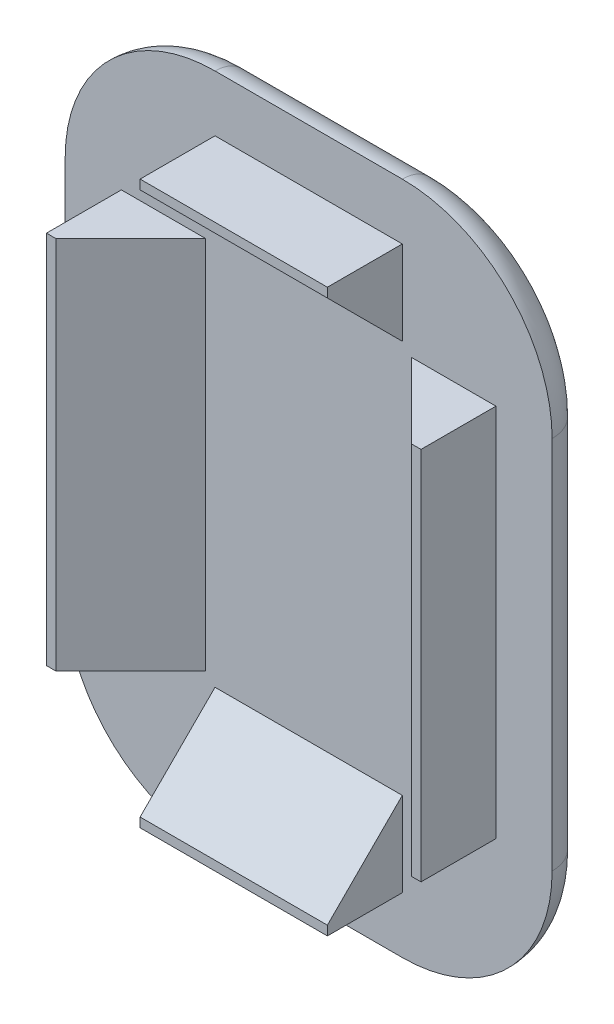
from build123d import *

# Parameters (mm, degrees)
EXTRUDE_1_DEPTH = 2
SKETCH_2_W      = 0.5
SKETCH_2_H      = 20
SKETCH_2_W_2    = 10
SKETCH_2_H_2    = 0.5
EXTRUDE_2_DEPTH = 4
CHAMFER_1_SIZE  = 4
FILLET_1_R      = 2


with BuildPart() as part:
    # Эскиз1 → Бобышка-Вытянуть1 (new body)
    with BuildSketch(Plane.XY):
        with BuildLine():
            Line((-25.809245543, -34.533993398), (-22.574730597, -34.533993398))
            Line((-22.574730597, -34.533993398), (-19.086915297, -34.533993398))
            Line((-19.086915297, -34.533993398), (-15.809245543, -34.533993398))
            ThreePointArc((-15.809245543, -34.533993398), (-10.152391293, -32.190847647), (-7.809245543, -26.533993398))
            Line((-7.809245543, -26.533993398), (-7.809245543, -18.565345077))
            Line((-7.809245543, -18.565345077), (-7.809245543, -14.503170045))
            Line((-7.809245543, -14.503170045), (-7.809245543, -6.533993398))
            ThreePointArc((-7.809245543, -6.533993398), (-10.152391293, -0.877139148), (-15.809245543, 1.466006602))
            Line((-15.809245543, 1.466006602), (-19.086915297, 1.466006602))
            Line((-19.086915297, 1.466006602), (-22.574730597, 1.466006602))
            Line((-22.574730597, 1.466006602), (-25.809245543, 1.466006602))
            ThreePointArc((-25.809245543, 1.466006602), (-31.466099792, -0.877139148), (-33.809245543, -6.533993398))
            Line((-33.809245543, -6.533993398), (-33.809245543, -14.503170045))
            Line((-33.809245543, -14.503170045), (-33.809245543, -18.565345077))
            Line((-33.809245543, -18.565345077), (-33.809245543, -26.533993398))
            ThreePointArc((-33.809245543, -26.533993398), (-31.466099792, -32.190847647), (-25.809245543, -34.533993398))
        make_face()
    extrude(amount=EXTRUDE_1_DEPTH)

    # Эскиз2 → Бобышка-Вытянуть2 (add)
    with BuildSketch(Plane.XY.offset(2)):
        with Locations((-30.559245543, -16.533993398)):
            Rectangle(SKETCH_2_W, SKETCH_2_H)
        with Locations((-20.809245543, -31.283993398)):
            Rectangle(SKETCH_2_W_2, SKETCH_2_H_2)
        with Locations((-11.059245543, -16.533993398)):
            Rectangle(SKETCH_2_W, SKETCH_2_H)
        with Locations((-20.809245543, -1.783993398)):
            Rectangle(SKETCH_2_W_2, SKETCH_2_H_2)
    extrude(amount=EXTRUDE_2_DEPTH)

    # Фаска1
    chamfer_1_edges = [part.edges().sort_by_distance(p)[0] for p in [
        (-20.809245543, -31.033993398, 2),
        (-30.309245543, -16.533993398, 2),
        (-20.809245543, -2.033993398, 2),
        (-11.309245543, -16.533993398, 2),
    ]]
    chamfer(chamfer_1_edges, length=CHAMFER_1_SIZE - 0.0001)  # a hair under: the kernel refuses the full size

    # Скругление1
    fillet_1_edges = [part.edges().sort_by_distance(p)[0] for p in [
        (-31.466099792, -0.877139148, 0),
        (-20.809245543, 1.466006602, 0),
        (-10.152391293, -0.877139148, 0),
        (-7.809245543, -16.533993398, 0),
        (-10.152391293, -32.190847647, 0),
        (-20.809245543, -34.533993398, 0),
        (-31.466099792, -32.190847647, 0),
        (-33.809245543, -16.533993398, 0),
    ]]
    fillet(fillet_1_edges, radius=FILLET_1_R - 0.0001)  # a hair under: the kernel refuses the full size


solid = part.part
